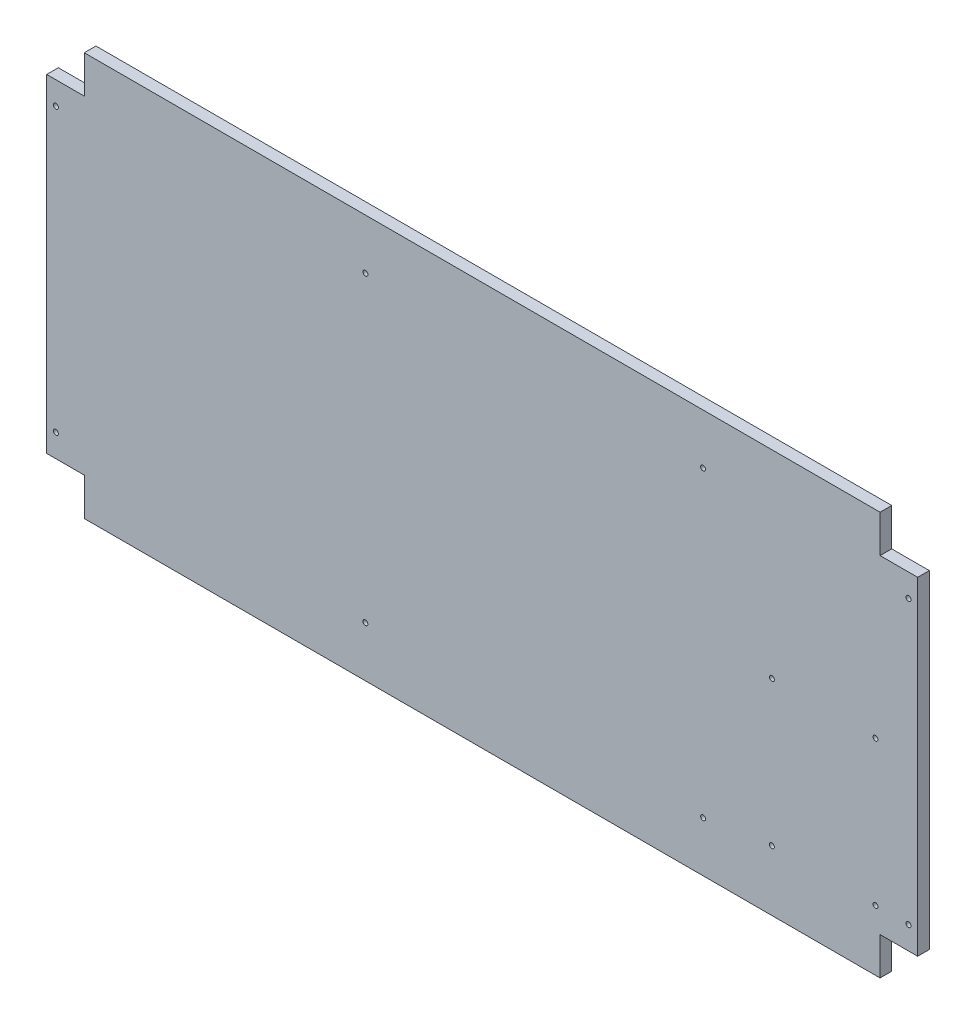
from build123d import *

# Parameters (mm, degrees)
SKETCH2_W           = 950
SKETCH2_H           = 440
BOSS_EXTRUDE1_DEPTH = 12.7
CUT_EXTRUDE1_REACH  = 525.628
SKETCH3_W           = 41
SKETCH3_H           = 41
CUT_EXTRUDE2_REACH  = 525.628
SKETCH4_R           = 2.75
CUT_EXTRUDE3_REACH  = 525.628
SKETCH6_R           = 2.665
CUT_EXTRUDE4_REACH  = 525.628
SKETCH7_R           = 2.665


with BuildPart() as part:
    # Sketch2 → Boss-Extrude1 (new body)
    with BuildSketch(Plane.XY):
        Rectangle(SKETCH2_W, SKETCH2_H)
    extrude(amount=BOSS_EXTRUDE1_DEPTH)

    # Sketch3 → Cut-Extrude1 (cut, up to next)
    with BuildSketch(Plane.XY.offset(12.7), mode=Mode.PRIVATE) as cut_extrude1_sk1:
        with Locations((-454.5, 199.5)):
            Rectangle(SKETCH3_W, SKETCH3_H)
    cut_extrude1_tool1 = extrude(cut_extrude1_sk1.sketch, amount=-CUT_EXTRUDE1_REACH, mode=Mode.PRIVATE) & part.part
    # Sketch3 → Cut-Extrude1 (cut, up to next)
    with BuildSketch(Plane.XY.offset(12.7), mode=Mode.PRIVATE) as cut_extrude1_sk2:
        with Locations((454.5, 199.5)):
            Rectangle(SKETCH3_W, SKETCH3_H)
    cut_extrude1_tool2 = extrude(cut_extrude1_sk2.sketch, amount=-CUT_EXTRUDE1_REACH, mode=Mode.PRIVATE) & part.part
    # Sketch3 → Cut-Extrude1 (cut, up to next)
    with BuildSketch(Plane.XY.offset(12.7), mode=Mode.PRIVATE) as cut_extrude1_sk3:
        with Locations((454.5, -199.5)):
            Rectangle(SKETCH3_W, SKETCH3_H)
    cut_extrude1_tool3 = extrude(cut_extrude1_sk3.sketch, amount=-CUT_EXTRUDE1_REACH, mode=Mode.PRIVATE) & part.part
    # Sketch3 → Cut-Extrude1 (cut, up to next)
    with BuildSketch(Plane.XY.offset(12.7), mode=Mode.PRIVATE) as cut_extrude1_sk4:
        with Locations((-454.5, -199.5)):
            Rectangle(SKETCH3_W, SKETCH3_H)
    cut_extrude1_tool4 = extrude(cut_extrude1_sk4.sketch, amount=-CUT_EXTRUDE1_REACH, mode=Mode.PRIVATE) & part.part
    add(cut_extrude1_tool1.solids().sort_by_distance((-454.5, 199.5, 12.7))[0], mode=Mode.SUBTRACT)
    add(cut_extrude1_tool2.solids().sort_by_distance((454.5, 199.5, 12.7))[0], mode=Mode.SUBTRACT)
    add(cut_extrude1_tool3.solids().sort_by_distance((454.5, -199.5, 12.7))[0], mode=Mode.SUBTRACT)
    add(cut_extrude1_tool4.solids().sort_by_distance((-454.5, -199.5, 12.7))[0], mode=Mode.SUBTRACT)

    # Sketch4 → Cut-Extrude2 (cut, up to next)
    with BuildSketch(Plane.XY.offset(12.7), mode=Mode.PRIVATE) as cut_extrude2_sk1:
        with Locations((-465, -154)):
            Circle(SKETCH4_R)
    cut_extrude2_tool1 = extrude(cut_extrude2_sk1.sketch, amount=-CUT_EXTRUDE2_REACH, mode=Mode.PRIVATE) & part.part
    # Sketch4 → Cut-Extrude2 (cut, up to next)
    with BuildSketch(Plane.XY.offset(12.7), mode=Mode.PRIVATE) as cut_extrude2_sk2:
        with Locations((-465, 154)):
            Circle(SKETCH4_R)
    cut_extrude2_tool2 = extrude(cut_extrude2_sk2.sketch, amount=-CUT_EXTRUDE2_REACH, mode=Mode.PRIVATE) & part.part
    # Sketch4 → Cut-Extrude2 (cut, up to next)
    with BuildSketch(Plane.XY.offset(12.7), mode=Mode.PRIVATE) as cut_extrude2_sk3:
        with Locations((465, -154)):
            Circle(SKETCH4_R)
    cut_extrude2_tool3 = extrude(cut_extrude2_sk3.sketch, amount=-CUT_EXTRUDE2_REACH, mode=Mode.PRIVATE) & part.part
    # Sketch4 → Cut-Extrude2 (cut, up to next)
    with BuildSketch(Plane.XY.offset(12.7), mode=Mode.PRIVATE) as cut_extrude2_sk4:
        with Locations((465, 154)):
            Circle(SKETCH4_R)
    cut_extrude2_tool4 = extrude(cut_extrude2_sk4.sketch, amount=-CUT_EXTRUDE2_REACH, mode=Mode.PRIVATE) & part.part
    add(cut_extrude2_tool1.solids().sort_by_distance((-465, -154, 12.7))[0], mode=Mode.SUBTRACT)
    add(cut_extrude2_tool2.solids().sort_by_distance((-465, 154, 12.7))[0], mode=Mode.SUBTRACT)
    add(cut_extrude2_tool3.solids().sort_by_distance((465, -154, 12.7))[0], mode=Mode.SUBTRACT)
    add(cut_extrude2_tool4.solids().sort_by_distance((465, 154, 12.7))[0], mode=Mode.SUBTRACT)

    # Sketch6 → Cut-Extrude3 (cut, up to next)
    with BuildSketch(Plane.XY.offset(12.7), mode=Mode.PRIVATE) as cut_extrude3_sk1:
        with Locations((-127.35, -165.1)):
            Circle(SKETCH6_R)
    cut_extrude3_tool1 = extrude(cut_extrude3_sk1.sketch, amount=-CUT_EXTRUDE3_REACH, mode=Mode.PRIVATE) & part.part
    # Sketch6 → Cut-Extrude3 (cut, up to next)
    with BuildSketch(Plane.XY.offset(12.7), mode=Mode.PRIVATE) as cut_extrude3_sk2:
        with Locations((240.95, -165.1)):
            Circle(SKETCH6_R)
    cut_extrude3_tool2 = extrude(cut_extrude3_sk2.sketch, amount=-CUT_EXTRUDE3_REACH, mode=Mode.PRIVATE) & part.part
    # Sketch6 → Cut-Extrude3 (cut, up to next)
    with BuildSketch(Plane.XY.offset(12.7), mode=Mode.PRIVATE) as cut_extrude3_sk3:
        with Locations((240.95, 165.1)):
            Circle(SKETCH6_R)
    cut_extrude3_tool3 = extrude(cut_extrude3_sk3.sketch, amount=-CUT_EXTRUDE3_REACH, mode=Mode.PRIVATE) & part.part
    # Sketch6 → Cut-Extrude3 (cut, up to next)
    with BuildSketch(Plane.XY.offset(12.7), mode=Mode.PRIVATE) as cut_extrude3_sk4:
        with Locations((-127.35, 165.1)):
            Circle(SKETCH6_R)
    cut_extrude3_tool4 = extrude(cut_extrude3_sk4.sketch, amount=-CUT_EXTRUDE3_REACH, mode=Mode.PRIVATE) & part.part
    add(cut_extrude3_tool1.solids().sort_by_distance((-127.35, -165.1, 12.7))[0], mode=Mode.SUBTRACT)
    add(cut_extrude3_tool2.solids().sort_by_distance((240.95, -165.1, 12.7))[0], mode=Mode.SUBTRACT)
    add(cut_extrude3_tool3.solids().sort_by_distance((240.95, 165.1, 12.7))[0], mode=Mode.SUBTRACT)
    add(cut_extrude3_tool4.solids().sort_by_distance((-127.35, 165.1, 12.7))[0], mode=Mode.SUBTRACT)

    # Sketch7 → Cut-Extrude4 (cut, up to next)
    with BuildSketch(Plane.XY.offset(12.7), mode=Mode.PRIVATE) as cut_extrude4_sk1:
        with Locations((429, 4)):
            Circle(SKETCH7_R)
    cut_extrude4_tool1 = extrude(cut_extrude4_sk1.sketch, amount=-CUT_EXTRUDE4_REACH, mode=Mode.PRIVATE) & part.part
    # Sketch7 → Cut-Extrude4 (cut, up to next)
    with BuildSketch(Plane.XY.offset(12.7), mode=Mode.PRIVATE) as cut_extrude4_sk2:
        with Locations((429, -154)):
            Circle(SKETCH7_R)
    cut_extrude4_tool2 = extrude(cut_extrude4_sk2.sketch, amount=-CUT_EXTRUDE4_REACH, mode=Mode.PRIVATE) & part.part
    # Sketch7 → Cut-Extrude4 (cut, up to next)
    with BuildSketch(Plane.XY.offset(12.7), mode=Mode.PRIVATE) as cut_extrude4_sk3:
        with Locations((316, 4)):
            Circle(SKETCH7_R)
    cut_extrude4_tool3 = extrude(cut_extrude4_sk3.sketch, amount=-CUT_EXTRUDE4_REACH, mode=Mode.PRIVATE) & part.part
    # Sketch7 → Cut-Extrude4 (cut, up to next)
    with BuildSketch(Plane.XY.offset(12.7), mode=Mode.PRIVATE) as cut_extrude4_sk4:
        with Locations((316, -154)):
            Circle(SKETCH7_R)
    cut_extrude4_tool4 = extrude(cut_extrude4_sk4.sketch, amount=-CUT_EXTRUDE4_REACH, mode=Mode.PRIVATE) & part.part
    add(cut_extrude4_tool1.solids().sort_by_distance((429, 4, 12.7))[0], mode=Mode.SUBTRACT)
    add(cut_extrude4_tool2.solids().sort_by_distance((429, -154, 12.7))[0], mode=Mode.SUBTRACT)
    add(cut_extrude4_tool3.solids().sort_by_distance((316, 4, 12.7))[0], mode=Mode.SUBTRACT)
    add(cut_extrude4_tool4.solids().sort_by_distance((316, -154, 12.7))[0], mode=Mode.SUBTRACT)


solid = part.part
